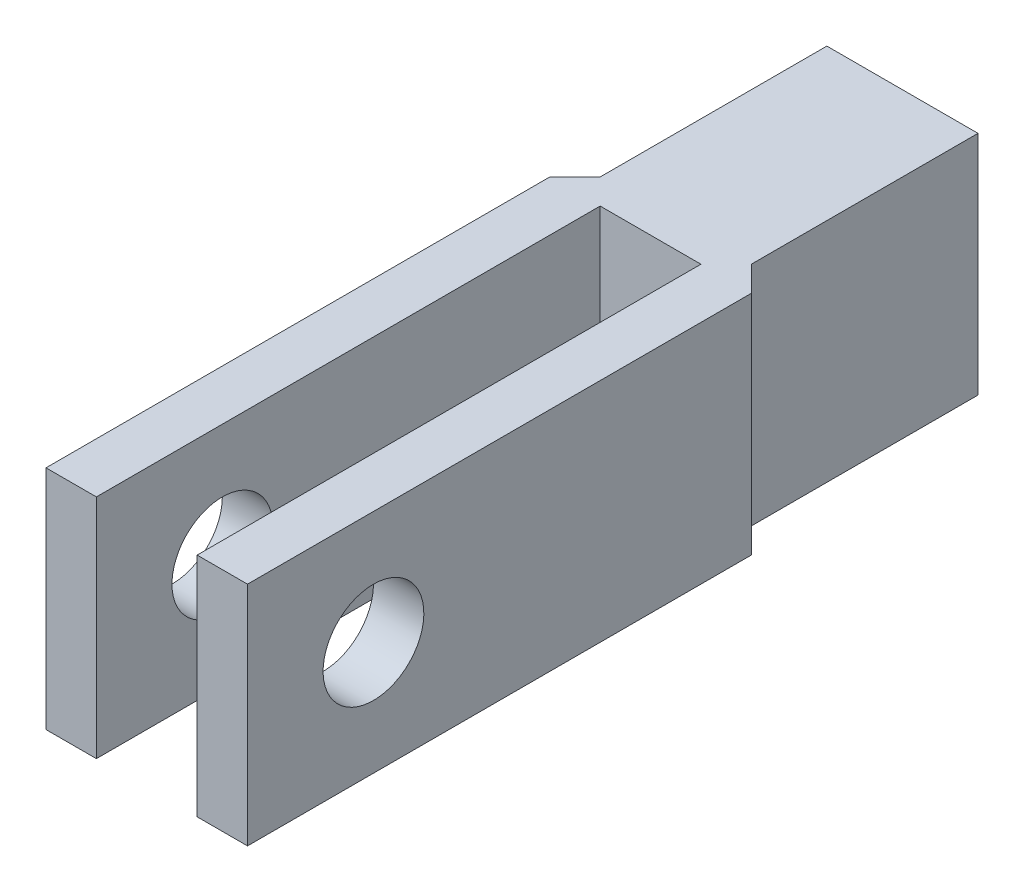
from build123d import *

# Parameters (mm, degrees)
SKETCH1_W             = 6
SKETCH1_H             = 9
BOSS_EXTRUDE1_DEPTH   = 10
M4_TAPPED_HOLE2_D     = 3.3
M4_TAPPED_HOLE2_DEPTH = 8
M4_TAPPED_HOLE2_TIP   = 0.991420021
SKETCH11_W            = 2
SKETCH11_H            = 9
BOSS_EXTRUDE5_DEPTH   = 20
SKETCH12_R            = 2
CUT_EXTRUDE1_DEPTH    = 2
CHAMFER1_SIZE         = 1
CHAMFER2_SIZE         = 1


with BuildPart() as part:
    # Sketch1 → Boss-Extrude1 (new body)
    with BuildSketch(Plane.XY):
        Rectangle(SKETCH1_W, SKETCH1_H)
    extrude(amount=BOSS_EXTRUDE1_DEPTH)

    # M4 Tapped Hole2
    with Locations(Plane(origin=(0, 0, 0), x_dir=(-1, 0, 0), z_dir=(0, 0, -1))):
        with Locations((0, 0)):
            Hole(M4_TAPPED_HOLE2_D / 2, depth=M4_TAPPED_HOLE2_DEPTH)
            with Locations((0, 0, -(M4_TAPPED_HOLE2_DEPTH + M4_TAPPED_HOLE2_TIP / 2))):  # 118° drill point
                Cone(0, M4_TAPPED_HOLE2_D / 2, M4_TAPPED_HOLE2_TIP, mode=Mode.SUBTRACT)

    # Sketch11 → Boss-Extrude5 (add)
    with BuildSketch(Plane.XY.offset(10)):
        with Locations((3, 0)):
            Rectangle(SKETCH11_W, SKETCH11_H)
    boss_extrude5 = extrude(amount=BOSS_EXTRUDE5_DEPTH)

    # Sketch12 → Cut-Extrude1 (cut)
    with BuildSketch(Plane(origin=(4, 0, 0), x_dir=(0, 0, -1), z_dir=(1, 0, 0))):
        with Locations(Location((-25, 0, 0), (0, 0, 90))):
            Circle(SKETCH12_R)
    cut_extrude1 = extrude(amount=-CUT_EXTRUDE1_DEPTH, mode=Mode.SUBTRACT)

    # Mirror1: Boss-Extrude5, Cut-Extrude1 across plane
    add(boss_extrude5.mirror(Plane(origin=(0, 0, 0), x_dir=(0, 0, 1), z_dir=(1, 0, 0))))
    add(cut_extrude1.mirror(Plane(origin=(0, 0, 0), x_dir=(0, 0, 1), z_dir=(1, 0, 0))), mode=Mode.SUBTRACT)

    # Chamfer1
    chamfer1_edges = [part.edges().sort_by_distance(p)[0] for p in [
        (3, 0, 10),
    ]]
    chamfer(chamfer1_edges, length=CHAMFER1_SIZE - 0.0001)  # a hair under: the kernel refuses the full size

    # Chamfer2
    chamfer2_edges = [part.edges().sort_by_distance(p)[0] for p in [
        (-3, 0, 10),
    ]]
    chamfer(chamfer2_edges, length=CHAMFER2_SIZE - 0.0001)  # a hair under: the kernel refuses the full size


solid = part.part
